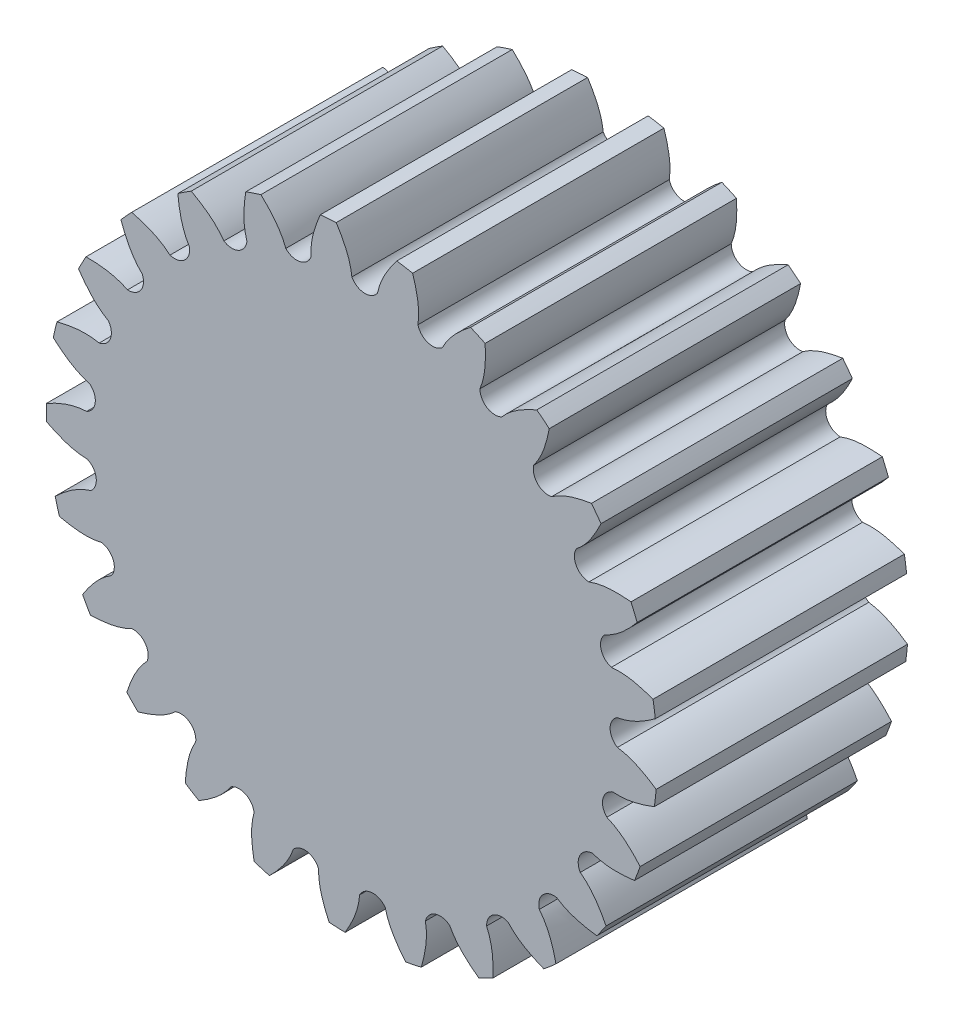
from build123d import *

# Parameters (mm, degrees)
SKETCH1_R                  = 5.370343328
BASEDIAMETER_EXTRUDE_DEPTH = 5.08
BOSS_EXTRUDE1_DEPTH        = 5.08
CUT_EXTRUDE1_DEPTH         = 12.216429399
CIRPATTERN4_DEPTH          = 5.08
CUT_EXTRUDE4_DEPTH         = 11.098511274
CIRPATTERN6_COUNT          = 25


# Read off the part's stored shape, not the designer's step: CirPattern4
with BuildPart() as part:
    # Sketch1 → BaseDiameter_Extrude (new body)
    with BuildSketch(Plane.XY):
        Circle(SKETCH1_R)
    extrude(amount=BASEDIAMETER_EXTRUDE_DEPTH)

    # Sketch7 → Boss-Extrude1 (add)
    with BuildSketch(Plane.XY):
        with BuildLine():
            Line((-5.370343328, 8.435715573), (-5.370343328, 0))
            ThreePointArc((-5.370343328, 0), (-3.797406184, 3.797406184), (0, 5.370343328))
            add(Edge.make_bspline(
                [(0, 5.370343328), (-0.024502303, 5.615490976), (-0.251415025, 6.130016119), (-0.868518802, 6.899721917), (-2.464181042, 8.075923117), (-4.152658348, 8.435118642), (-5.370343328, 8.435715573)],
                knots=[0, 0, 0, 0, 0.111140904, 0.250028182, 0.444466736, 1, 1, 1, 1], degree=3))
        make_face()
    extrude(amount=BOSS_EXTRUDE1_DEPTH)

    # Sketch8 → Cut-Extrude1 (cut, symmetric)
    with BuildSketch(Plane.XY):
        with BuildLine():
            Line((-0.315751044, 6.164118276), (-0.432111435, 8.435715573))
            Line((-0.432111435, 8.435715573), (-5.370343328, 8.435715573))
            Line((-5.370343328, 8.435715573), (-5.370343328, 0))
            ThreePointArc((-5.370343328, 0), (-3.941446988, 3.64768188), (-0.415135705, 5.354273976))
            Line((-0.415135705, 5.354273976), (-0.477120445, 6.153731301))
            ThreePointArc((-0.477120445, 6.153731301), (-0.396469761, 6.159453269), (-0.315751044, 6.164118276))
        make_face()
    extrude(amount=CUT_EXTRUDE1_DEPTH, both=True, mode=Mode.SUBTRACT)

    # Mirror2: part across plane


with BuildPart() as part_1:
    add(part.part)
    add(part.part.mirror(Plane(origin=(-0.415135705, 5.354273976, 5.08), x_dir=(0, 0, 1), z_dir=(-0.9970077607161457, -0.07730152050106644, 0))))

    # CirPattern4 outline → CirPattern4 (add)
    with BuildSketch(Plane.XY):
        with BuildLine():
            ThreePointArc((0.517808263, 5.345321512), (0.929460338, 5.289299665), (1.335550077, 5.201624118))
            add(Edge.make_bspline(
                [(1.335550077, 5.201624118), (1.372783299, 5.445163476), (1.325007768, 5.733810079), (1.240220554, 6.00917201), (1.227122734, 6.048985257)],
                knots=[0, 0, 0, 0, 0.111140904, 0.130084568, 0.130084568, 0.130084568, 0.130084568], degree=3))
            ThreePointArc((1.227122734, 6.048985257), (1.068239914, 6.079055546), (0.908623886, 6.104953356))
            add(Edge.make_bspline(
                [(0.517808263, 5.345321512), (0.565833529, 5.586964443), (0.70915286, 5.842030968), (0.882737528, 6.07199059), (0.908623886, 6.104953356)],
                knots=[0, 0, 0, 0, 0.111140904, 0.130084568, 0.130084568, 0.130084568, 0.130084568], degree=3))
        make_face()
        with BuildLine():
            add(Edge.make_bspline(
                [(-2.121369437, 4.933596981), (-2.195696946, 5.168486644), (-2.192984495, 5.461047758), (-2.151654984, 5.746187963), (-2.144850528, 5.787544302)],
                knots=[0, 0, 0, 0, 0.111140904, 0.130084568, 0.130084568, 0.130084568, 0.130084568], degree=3))
            ThreePointArc((-2.121369437, 4.933596981), (-1.733647244, 5.08281956), (-1.335550076, 5.201624116))
            add(Edge.make_bspline(
                [(-1.335550076, 5.201624116), (-1.420248336, 5.432976526), (-1.601170914, 5.662903435), (-1.808127138, 5.863358383), (-1.838785022, 5.891937074)],
                knots=[0, 0, 0, 0, 0.111140904, 0.130084568, 0.130084568, 0.130084568, 0.130084568], degree=3))
            ThreePointArc((-1.838785022, 5.891937074), (-1.992501571, 5.841745486), (-2.144850528, 5.787544302))
        make_face()
        with BuildLine():
            add(Edge.make_bspline(
                [(-3.281658392, 4.251035833), (-3.412065449, 4.460061506), (-3.482195205, 4.744105834), (-3.513075622, 5.030566066), (-3.516769844, 5.07231532)],
                knots=[0, 0, 0, 0, 0.111140904, 0.130084568, 0.130084568, 0.130084568, 0.130084568], degree=3))
            ThreePointArc((-3.281658392, 4.251035833), (-2.94322735, 4.491992899), (-2.587182629, 4.706067731))
            add(Edge.make_bspline(
                [(-2.587182629, 4.706067731), (-2.726754942, 4.909088179), (-2.959174001, 5.086797896), (-3.209479434, 5.229487263), (-3.246281376, 5.249543796)],
                knots=[0, 0, 0, 0, 0.111140904, 0.130084568, 0.130084568, 0.130084568, 0.130084568], degree=3))
            ThreePointArc((-3.246281376, 5.249543796), (-3.382686497, 5.162701319), (-3.516769844, 5.07231532))
        make_face()
        with BuildLine():
            add(Edge.make_bspline(
                [(-4.235748681, 3.30136647), (-4.414041331, 3.471394301), (-4.552606784, 3.729074292), (-4.653756798, 3.998855203), (-4.667717577, 4.038374111)],
                knots=[0, 0, 0, 0, 0.111140904, 0.130084568, 0.130084568, 0.130084568, 0.130084568], degree=3))
            ThreePointArc((-4.235748681, 3.30136647), (-3.967873657, 3.618917804), (-3.676252981, 3.914811803))
            add(Edge.make_bspline(
                [(-3.676252981, 3.914811803), (-3.861929506, 4.076743768), (-4.131241303, 4.191070138), (-4.409168333, 4.267028226), (-4.449801931, 4.277302376)],
                knots=[0, 0, 0, 0, 0.111140904, 0.130084568, 0.130084568, 0.130084568, 0.130084568], degree=3))
            ThreePointArc((-4.449801931, 4.277302376), (-4.560324788, 4.15926564), (-4.667717577, 4.038374111))
        make_face()
        with BuildLine():
            add(Edge.make_bspline(
                [(-4.923691302, 2.14426011), (-5.138666763, 2.264606625), (-5.336961335, 2.479731299), (-5.50202532, 2.71588156), (-5.525375448, 2.750687005)],
                knots=[0, 0, 0, 0, 0.111140904, 0.130084568, 0.130084568, 0.130084568, 0.130084568], degree=3))
            ThreePointArc((-4.923691302, 2.14426011), (-4.74320387, 2.518452794), (-4.534330839, 2.877573852))
            add(Edge.make_bspline(
                [(-4.534330839, 2.877573852), (-4.754444837, 2.988242553), (-5.043727521, 3.032002029), (-5.33181297, 3.036456113), (-5.373725066, 3.036302316)],
                knots=[0, 0, 0, 0, 0.111140904, 0.130084568, 0.130084568, 0.130084568, 0.130084568], degree=3))
            ThreePointArc((-5.373725066, 3.036302316), (-5.451421102, 2.894488005), (-5.525375448, 2.750687005))
        make_face()
        with BuildLine():
            add(Edge.make_bspline(
                [(-5.302260291, 0.852422002), (-5.540410863, 0.915525386), (-5.785974978, 1.074577668), (-6.004581356, 1.262259091), (-6.035853659, 1.290164118)],
                knots=[0, 0, 0, 0, 0.111140904, 0.130084568, 0.130084568, 0.130084568, 0.130084568], degree=3))
            ThreePointArc((-5.302260291, 0.852422002), (-5.220501139, 1.259744133), (-5.107500013, 1.659527353))
            add(Edge.make_bspline(
                [(-5.107500013, 1.659527353), (-5.348220913, 1.711979068), (-5.639297788, 1.682422082), (-5.919440189, 1.615092294), (-5.959997292, 1.604520215)],
                knots=[0, 0, 0, 0, 0.111140904, 0.130084568, 0.130084568, 0.130084568, 0.130084568], degree=3))
            ThreePointArc((-5.959997292, 1.604520215), (-5.999984579, 1.447839043), (-6.035853659, 1.290164118))
        make_face()
        with BuildLine():
            add(Edge.make_bspline(
                [(-5.347668765, -0.492976916), (-5.594030573, -0.49108168), (-5.871434533, -0.39809563), (-6.129847462, -0.27067576), (-6.167076986, -0.251424526)],
                knots=[0, 0, 0, 0, 0.111140904, 0.130084568, 0.130084568, 0.130084568, 0.130084568], degree=3))
            ThreePointArc((-5.347668765, -0.492976916), (-5.369775122, -0.078118885), (-5.359746178, 0.337206647))
            add(Edge.make_bspline(
                [(-5.359746178, 0.337206647), (-5.6059486, 0.328145642), (-5.880530236, 0.227129368), (-6.135127211, 0.092246287), (-6.171780969, 0.071920208)],
                knots=[0, 0, 0, 0, 0.111140904, 0.130084568, 0.130084568, 0.130084568, 0.130084568], degree=3))
            ThreePointArc((-6.171780969, 0.071920208), (-6.171546958, -0.089782971), (-6.167076986, -0.251424526))
        make_face()
        with BuildLine():
            add(Edge.make_bspline(
                [(-5.057063543, -1.807400282), (-5.296156768, -1.866832278), (-5.587970263, -1.845755115), (-5.869952708, -1.786603056), (-5.910800185, -1.777215242)],
                knots=[0, 0, 0, 0, 0.111140904, 0.130084568, 0.130084568, 0.130084568, 0.130084568], degree=3))
            ThreePointArc((-5.057063543, -1.807400282), (-5.181646386, -1.411073405), (-5.275219779, -1.006301992))
            add(Edge.make_bspline(
                [(-5.275219779, -1.006301992), (-5.511433919, -1.076306381), (-5.752267342, -1.24243472), (-5.965321627, -1.436395894), (-5.995768949, -1.46519881)],
                knots=[0, 0, 0, 0, 0.111140904, 0.130084568, 0.130084568, 0.130084568, 0.130084568], degree=3))
            ThreePointArc((-5.995768949, -1.46519881), (-5.955328345, -1.621763591), (-5.910800185, -1.777215242))
        make_face()
        with BuildLine():
            add(Edge.make_bspline(
                [(-4.448704421, -3.00825804), (-4.665505956, -3.125282938), (-4.95339327, -3.177439018), (-5.241227237, -3.190271513), (-5.28312607, -3.191336988)],
                knots=[0, 0, 0, 0, 0.111140904, 0.130084568, 0.130084568, 0.130084568, 0.130084568], degree=3))
            ThreePointArc((-4.448704421, -3.00825804), (-4.66793575, -2.655364995), (-4.859231921, -2.286580976))
            add(Edge.make_bspline(
                [(-4.859231921, -2.286580976), (-5.070615575, -2.413130116), (-5.262568335, -2.633932065), (-5.420692946, -2.874784037), (-5.443020715, -2.910253999)],
                knots=[0, 0, 0, 0, 0.111140904, 0.130084568, 0.130084568, 0.130084568, 0.130084568], degree=3))
            ThreePointArc((-5.443020715, -2.910253999), (-5.364914549, -3.051842839), (-5.28312607, -3.191336988))
        make_face()
        with BuildLine():
            add(Edge.make_bspline(
                [(-3.560816838, -4.020095882), (-3.741704246, -4.187360577), (-4.007576361, -4.309472742), (-4.283176183, -4.393483477), (-4.323493714, -4.404935294)],
                knots=[0, 0, 0, 0, 0.111140904, 0.130084568, 0.130084568, 0.130084568, 0.130084568], degree=3))
            ThreePointArc((-3.560816838, -4.020095882), (-3.860921544, -3.732810236), (-4.13792065, -3.423185669))
            add(Edge.make_bspline(
                [(-4.13792065, -3.423185669), (-4.311191806, -3.598328012), (-4.442202806, -3.859929771), (-4.535462191, -4.132538928), (-4.548267472, -4.172447225)],
                knots=[0, 0, 0, 0, 0.111140904, 0.130084568, 0.130084568, 0.130084568, 0.130084568], degree=3))
            ThreePointArc((-4.548267472, -4.172447225), (-4.437403442, -4.290163578), (-4.323493714, -4.404935294))
        make_face()
        with BuildLine():
            add(Edge.make_bspline(
                [(-2.449190038, -4.779336316), (-2.582797497, -4.986330951), (-2.809948691, -5.170726444), (-3.055997417, -5.320636716), (-3.092200347, -5.341755316)],
                knots=[0, 0, 0, 0, 0.111140904, 0.130084568, 0.130084568, 0.130084568, 0.130084568], degree=3))
            ThreePointArc((-2.449190038, -4.779336316), (-2.811311438, -4.575709282), (-3.156608607, -4.344699016))
            add(Edge.make_bspline(
                [(-3.156608607, -4.344699016), (-3.28088, -4.557429724), (-3.342717337, -4.843393894), (-3.365251667, -5.130631198), (-3.367729856, -5.172470247)],
                knots=[0, 0, 0, 0, 0.111140904, 0.130084568, 0.130084568, 0.130084568, 0.130084568], degree=3))
            ThreePointArc((-3.367729856, -5.172470247), (-3.231073957, -5.258917562), (-3.092200347, -5.341755316))
        make_face()
        with BuildLine():
            add(Edge.make_bspline(
                [(-1.18367162, -5.238273471), (-1.261604082, -5.471991813), (-1.435761609, -5.707084388), (-1.636799094, -5.913474782), (-1.66661266, -5.942933205)],
                knots=[0, 0, 0, 0, 0.111140904, 0.130084568, 0.130084568, 0.130084568, 0.130084568], degree=3))
            ThreePointArc((-1.18367162, -5.238273471), (-1.585056295, -5.131099686), (-1.976955235, -4.993218946))
            add(Edge.make_bspline(
                [(-1.976955235, -4.993218946), (-2.044418438, -5.230171366), (-2.033196644, -5.522529766), (-1.983590003, -5.806347042), (-1.975585387, -5.847487941)],
                knots=[0, 0, 0, 0, 0.111140904, 0.130084568, 0.130084568, 0.130084568, 0.130084568], degree=3))
            ThreePointArc((-1.975585387, -5.847487941), (-1.821724212, -5.897234414), (-1.66661266, -5.942933205))
        make_face()
        with BuildLine():
            add(Edge.make_bspline(
                [(0.156221239, -5.368070639), (0.138860556, -5.613827305), (0.028639654, -5.88484523), (-0.114754664, -6.13474748), (-0.136305571, -6.170694745)],
                knots=[0, 0, 0, 0, 0.111140904, 0.130084568, 0.130084568, 0.130084568, 0.130084568], degree=3))
            ThreePointArc((0.156221239, -5.368070639), (-0.259206235, -5.364084226), (-0.673082495, -5.327996566))
            add(Edge.make_bspline(
                [(-0.673082495, -5.327996566), (-0.679498547, -5.574282105), (-0.595922728, -5.854664782), (-0.477292085, -6.117228747), (-0.459307623, -6.155086461)],
                knots=[0, 0, 0, 0, 0.111140904, 0.130084568, 0.130084568, 0.130084568, 0.130084568], degree=3))
            ThreePointArc((-0.459307623, -6.155086461), (-0.297908835, -6.16500634), (-0.136305571, -6.170694745))
        make_face()
        with BuildLine():
            add(Edge.make_bspline(
                [(1.486298143, -5.160572186), (1.530600076, -5.402925381), (1.491241383, -5.692839603), (1.414500223, -5.970551431), (1.402566099, -6.010728839)],
                knots=[0, 0, 0, 0, 0.111140904, 0.130084568, 0.130084568, 0.130084568, 0.130084568], degree=3))
            ThreePointArc((1.486298143, -5.160572186), (1.082930707, -5.260023627), (0.673082495, -5.327996567))
            add(Edge.make_bspline(
                [(0.673082495, -5.327996567), (0.728116737, -5.5681402), (0.878795204, -5.818929678), (1.05899585, -6.043742472), (1.085830128, -6.075938263)],
                knots=[0, 0, 0, 0, 0.111140904, 0.130084568, 0.130084568, 0.130084568, 0.130084568], degree=3))
            ThreePointArc((1.085830128, -6.075938263), (1.24462525, -6.045408243), (1.402566099, -6.010728839))
        make_face()
        with BuildLine():
            add(Edge.make_bspline(
                [(2.722985468, -4.628816004), (2.826166363, -4.852537785), (2.860142931, -5.143131927), (2.854876859, -5.431203678), (2.853309383, -5.473086735)],
                knots=[0, 0, 0, 0, 0.111140904, 0.130084568, 0.130084568, 0.130084568, 0.130084568], degree=3))
            ThreePointArc((2.722985468, -4.628816004), (2.35702313, -4.825456397), (1.976955236, -4.993218949))
            add(Edge.make_bspline(
                [(1.976955236, -4.993218949), (2.089981769, -5.212131567), (2.298295202, -5.417569822), (2.528743182, -5.59050563), (2.562741179, -5.615016517)],
                knots=[0, 0, 0, 0, 0.111140904, 0.130084568, 0.130084568, 0.130084568, 0.130084568], degree=3))
            ThreePointArc((2.562741179, -5.615016517), (2.708954953, -5.545954914), (2.853309383, -5.473086735))
        make_face()
        with BuildLine():
            add(Edge.make_bspline(
                [(3.788577602, -3.806214288), (3.944154224, -3.997247393), (4.04933118, -4.270262357), (4.115871083, -4.550593423), (4.124768744, -4.591550462)],
                knots=[0, 0, 0, 0, 0.111140904, 0.130084568, 0.130084568, 0.130084568, 0.130084568], degree=3))
            ThreePointArc((3.788577602, -3.806214288), (3.483015121, -4.087687996), (3.156608609, -4.34469902))
            add(Edge.make_bspline(
                [(3.156608609, -4.34469902), (3.32052556, -4.528625539), (3.573384859, -4.675804129), (3.839600279, -4.785996759), (3.878625776, -4.801282634)],
                knots=[0, 0, 0, 0, 0.111140904, 0.130084568, 0.130084568, 0.130084568, 0.130084568], degree=3))
            ThreePointArc((3.878625776, -4.801282634), (4.003071053, -4.69802884), (4.124768744, -4.591550462))
        make_face()
        with BuildLine():
            add(Edge.make_bspline(
                [(4.616119472, -2.744454131), (4.81431637, -2.890795247), (4.984085059, -3.129076498), (5.118249989, -3.384052648), (5.137053716, -3.421510188)],
                knots=[0, 0, 0, 0, 0.111140904, 0.130084568, 0.130084568, 0.130084568, 0.130084568], degree=3))
            ThreePointArc((4.616119472, -2.744454131), (4.390156464, -3.093075123), (4.137920655, -3.423185672))
            add(Edge.make_bspline(
                [(4.137920655, -3.423185672), (4.342428518, -3.560569313), (4.623945604, -3.640240467), (4.909201169, -3.68076611), (4.950802052, -3.685866504)],
                knots=[0, 0, 0, 0, 0.111140904, 0.130084568, 0.130084568, 0.130084568, 0.130084568], degree=3))
            ThreePointArc((4.950802052, -3.685866504), (5.045659477, -3.554908336), (5.137053716, -3.421510188))
        make_face()
        with BuildLine():
            add(Edge.make_bspline(
                [(5.153613579, -1.510249827), (5.381977312, -1.602703804), (5.605670543, -1.791279255), (5.799030425, -2.004879398), (5.826558709, -2.036483845)],
                knots=[0, 0, 0, 0, 0.111140904, 0.130084568, 0.130084568, 0.130084568, 0.130084568], degree=3))
            ThreePointArc((5.153613579, -1.510249827), (5.021448129, -1.904112965), (4.859231927, -2.286580979))
            add(Edge.make_bspline(
                [(4.859231927, -2.286580979), (5.091480721, -2.368789423), (5.383966841, -2.375947108), (5.670338896, -2.344259389), (5.711901226, -2.338853826)],
                knots=[0, 0, 0, 0, 0.111140904, 0.130084568, 0.130084568, 0.130084568, 0.130084568], degree=3))
            ThreePointArc((5.711901226, -2.338853826), (5.771210559, -2.188419868), (5.826558709, -2.036483845))
        make_face()
        with BuildLine():
            add(Edge.make_bspline(
                [(5.36728719, -0.181150972), (5.611468826, -0.213908586), (5.875031131, -0.340929349), (6.115436452, -0.499732203), (6.149959591, -0.523497732)],
                knots=[0, 0, 0, 0, 0.111140904, 0.130084568, 0.130084568, 0.130084568, 0.130084568], degree=3))
            ThreePointArc((5.36728719, -0.181150972), (5.337223741, -0.595508386), (5.275219787, -1.006301993))
            add(Edge.make_bspline(
                [(5.275219787, -1.006301993), (5.520616466, -1.028169781), (5.805693641, -0.962364254), (6.075188375, -0.860454229), (6.11410064, -0.844882361)],
                knots=[0, 0, 0, 0, 0.111140904, 0.130084568, 0.130084568, 0.130084568, 0.130084568], degree=3))
            ThreePointArc((6.11410064, -0.844882361), (6.134135257, -0.684424931), (6.149959591, -0.523497732))
        make_face()
        with BuildLine():
            add(Edge.make_bspline(
                [(5.243714408, 1.159330264), (5.488371116, 1.188327295), (5.775241905, 1.130842403), (6.047587116, 1.036815004), (6.086935893, 1.022381669)],
                knots=[0, 0, 0, 0, 0.111140904, 0.130084568, 0.130084568, 0.130084568, 0.130084568], degree=3))
            ThreePointArc((5.243714408, 1.159330264), (5.317641956, 0.750514175), (5.359746186, 0.337206648))
            add(Edge.make_bspline(
                [(5.359746186, 0.337206648), (5.602871575, 0.377053549), (5.862627357, 0.511687485), (6.098311426, 0.677416434), (6.132128624, 0.70217617)],
                knots=[0, 0, 0, 0, 0.111140904, 0.130084568, 0.130084568, 0.130084568, 0.130084568], degree=3))
            ThreePointArc((6.132128624, 0.70217617), (6.111629677, 0.862574942), (6.086935893, 1.022381669))
        make_face()
        with BuildLine():
            add(Edge.make_bspline(
                [(4.790659765, 2.426966517), (5.020418864, 2.515896201), (5.312572992, 2.531559167), (5.599745639, 2.508215311), (5.641447627, 2.504021069)],
                knots=[0, 0, 0, 0, 0.111140904, 0.130084568, 0.130084568, 0.130084568, 0.130084568], degree=3))
            ThreePointArc((4.790659765, 2.426966517), (4.96393317, 2.04937917), (5.10750002, 1.659527355))
            add(Edge.make_bspline(
                [(5.10750002, 1.659527355), (5.333077657, 1.758585219), (5.551190635, 1.953588017), (5.738255142, 2.172722532), (5.764852415, 2.20511439)],
                knots=[0, 0, 0, 0, 0.111140904, 0.130084568, 0.130084568, 0.130084568, 0.130084568], degree=3))
            ThreePointArc((5.764852415, 2.20511439), (5.705107927, 2.355376059), (5.641447627, 2.504021069))
        make_face()
        with BuildLine():
            add(Edge.make_bspline(
                [(4.03659035, 3.542107537), (4.237015231, 3.685382096), (4.516095578, 3.773208758), (4.80005155, 3.822015226), (4.841486459, 3.828323616)],
                knots=[0, 0, 0, 0, 0.111140904, 0.130084568, 0.130084568, 0.130084568, 0.130084568], degree=3))
            ThreePointArc((4.03659035, 3.542107537), (4.298322207, 3.219474134), (4.534330844, 2.877573855))
            add(Edge.make_bspline(
                [(4.534330844, 2.877573855), (4.728186856, 3.029618511), (4.89095219, 3.27273743), (5.017643184, 3.531508482), (5.035349327, 3.569497163)],
                knots=[0, 0, 0, 0, 0.111140904, 0.130084568, 0.130084568, 0.130084568, 0.130084568], degree=3))
            ThreePointArc((5.035349327, 3.569497163), (4.940113264, 3.700180235), (4.841486459, 3.828323616))
        make_face()
        with BuildLine():
            add(Edge.make_bspline(
                [(3.028887118, 4.434684914), (3.187384349, 4.623301881), (3.435855271, 4.777773766), (3.698752569, 4.895663868), (3.73731689, 4.912078511)],
                knots=[0, 0, 0, 0, 0.111140904, 0.130084568, 0.130084568, 0.130084568, 0.130084568], degree=3))
            ThreePointArc((3.028887118, 4.434684914), (3.362631851, 4.187277698), (3.676252985, 3.914811807))
            add(Edge.make_bspline(
                [(3.676252985, 3.914811807), (3.826206686, 4.11028973), (3.923397231, 4.386248714), (3.98175425, 4.668396766), (3.989456721, 4.709595302)],
                knots=[0, 0, 0, 0, 0.111140904, 0.130084568, 0.130084568, 0.130084568, 0.130084568], degree=3))
            ThreePointArc((3.989456721, 4.709595302), (3.864713116, 4.812488479), (3.73731689, 4.912078511))
        make_face()
        with BuildLine():
            add(Edge.make_bspline(
                [(1.830867768, 5.048614728), (1.937478385, 5.270722604), (2.139727541, 5.482133677), (2.36504736, 5.661699944), (2.398317957, 5.687189448)],
                knots=[0, 0, 0, 0, 0.111140904, 0.130084568, 0.130084568, 0.130084568, 0.130084568], degree=3))
            ThreePointArc((1.830867768, 5.048614728), (2.215654969, 4.891979204), (2.58718263, 4.706067734))
            add(Edge.make_bspline(
                [(2.58718263, 4.706067734), (2.683811878, 4.932696329), (2.709320794, 5.224155859), (2.695677054, 5.511952512), (2.692891878, 5.553772247)],
                knots=[0, 0, 0, 0, 0.111140904, 0.130084568, 0.130084568, 0.130084568, 0.130084568], degree=3))
            ThreePointArc((2.692891878, 5.553772247), (2.54647883, 5.622410373), (2.398317957, 5.687189448))
        make_face()
    extrude(amount=CIRPATTERN4_DEPTH)

    # Sketch10 → Cut-Extrude4 (cut, symmetric)
    with BuildSketch(Plane.XY):
        with BuildLine():
            ThreePointArc((0.517808263, 5.345321511), (0.259206235, 5.364084226), (0, 5.370343328))
            ThreePointArc((0, 5.370343328), (0.251931571, 5.213540361), (0.517808263, 5.345321511))
        make_face()
    cut_extrude4 = extrude(amount=CUT_EXTRUDE4_DEPTH, both=True, mode=Mode.SUBTRACT)

    # CirPattern6: Cut-Extrude4 ×25 about axis
    cirpattern6_axis = Axis((0, 0, 0), (0, 0, 1))
    for i in range(1, CIRPATTERN6_COUNT):
        add(cut_extrude4.rotate(cirpattern6_axis, i * 360 / CIRPATTERN6_COUNT), mode=Mode.SUBTRACT)


solid = part_1.part
